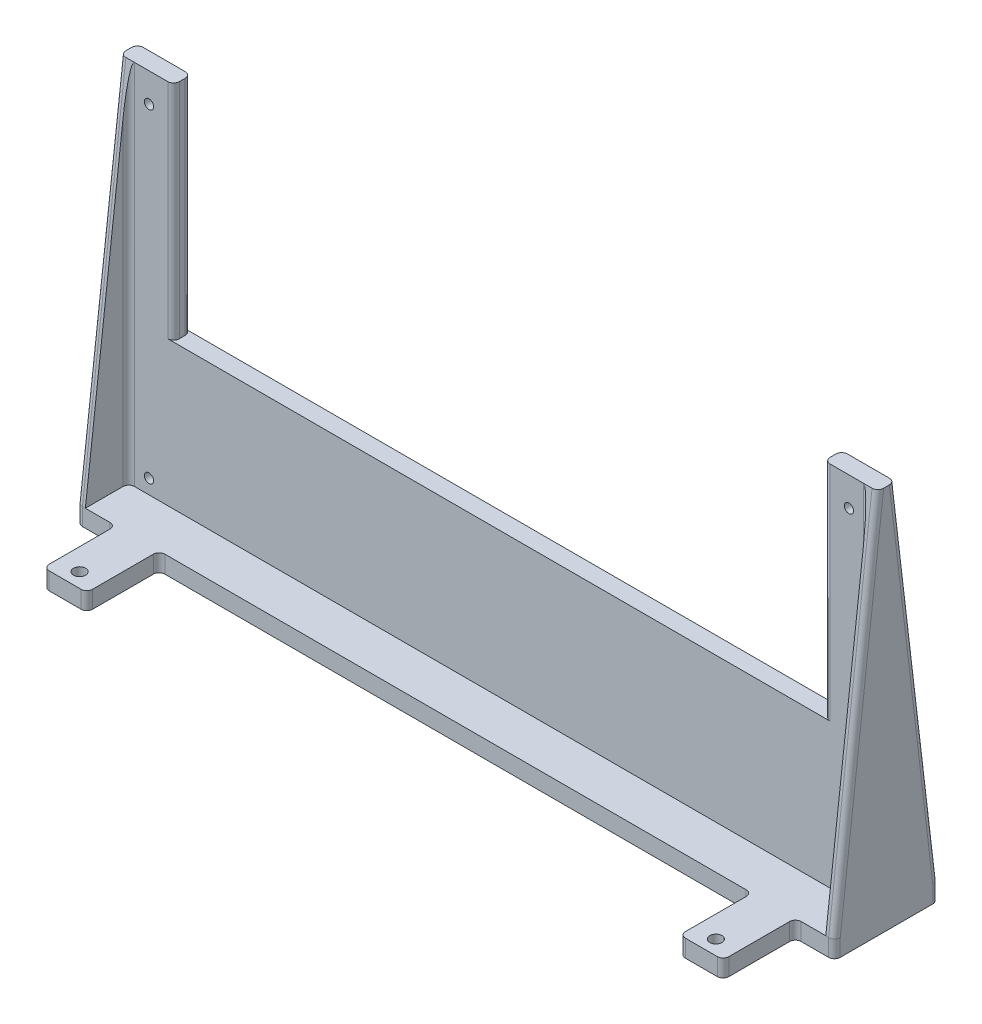
from build123d import *

# Parameters (mm, degrees)
SKETCH1_R               = 1.6
BOSS_EXTRUDE1_DEPTH     = 6
SKETCH5_W               = 262
SKETCH5_H               = 6
BOSS_EXTRUDE3_DEPTH     = 40
SKETCH5_2_W             = 262
SKETCH5_2_H             = 6
BOSS_EXTRUDE5_DEPTH     = 30
SKETCH3_R               = 2.1
CUT_EXTRUDE1_DEPTH      = 189.164821367
SKETCH6_W               = 225
SKETCH6_H               = 77
CUT_EXTRUDE2_DEPTH      = 153.47950682
BOSS_EXTRUDE7_DEPTH     = 20
CUT_EXTRUDE4_DEPTH      = 189.164821367
CUT_EXTRUDE4_DEPTH_BACK = 189.164821367
SKETCH11_W              = 36
SKETCH11_H              = 9
SKETCH11_W_2            = 13.5
SKETCH11_H_2            = 25
SKETCH11_W_3            = 205
BOSS_EXTRUDE4_DEPTH     = 3
BOSS_EXTRUDE6_DEPTH     = 3
FILLET1_R               = 2


with BuildPart() as part:
    # Sketch1 → Boss-Extrude1 (new body)
    with BuildSketch(Plane.XY):
        Polygon((-131, -66), (-131, 66), (131, 66), (131, -66), (131, -67), (-131, -67), align=None)
        with Locations((-121, 56)):
            Circle(SKETCH1_R, mode=Mode.SUBTRACT)
        with Locations((121, 56)):
            Circle(SKETCH1_R, mode=Mode.SUBTRACT)
        with Locations((121, -56)):
            Circle(SKETCH1_R, mode=Mode.SUBTRACT)
        with Locations((-121, -56)):
            Circle(SKETCH1_R, mode=Mode.SUBTRACT)
    extrude(amount=BOSS_EXTRUDE1_DEPTH)

    # Sketch5 → Boss-Extrude3 (add)
    with BuildSketch(Plane.XY.offset(6)):
        with Locations((0, -64)):
            Rectangle(SKETCH5_W, SKETCH5_H)
    extrude(amount=BOSS_EXTRUDE3_DEPTH)

    # Sketch5<2> → Boss-Extrude5 (add)
    with BuildSketch(Plane.XY.offset(6)):
        with Locations((0, -64)):
            Rectangle(SKETCH5_2_W, SKETCH5_2_H)
    extrude(amount=-BOSS_EXTRUDE5_DEPTH)

    # Sketch3 → Cut-Extrude1 (cut, through all)
    with BuildSketch(Plane(origin=(0, -61, 0), x_dir=(1, 0, 0), z_dir=(0, 1, 0))):
        with Locations(Location((-110, -41, 0), (0, 0, 270))):
            Circle(SKETCH3_R)
        with Locations(Location((110, -41, 0), (0, 0, 270))):
            Circle(SKETCH3_R)
        with Locations(Location((-90, 19, 0), (0, 0, 270))):
            Circle(SKETCH3_R)
        with Locations(Location((90, 19, 0), (0, 0, 270))):
            Circle(SKETCH3_R)
    extrude(amount=-CUT_EXTRUDE1_DEPTH, mode=Mode.SUBTRACT)

    # Sketch6 → Cut-Extrude2 (cut, through all)
    with BuildSketch(Plane.XY.offset(6)):
        with Locations((0, 27.5)):
            Rectangle(SKETCH6_W, SKETCH6_H)
    extrude(amount=-CUT_EXTRUDE2_DEPTH, mode=Mode.SUBTRACT)

    # Sketch9 → Boss-Extrude7 (add)
    with BuildSketch(Plane(origin=(0, -61, 0), x_dir=(1, 0, 0), z_dir=(0, 1, 0))):
        Polygon((-81.5, 24), (-81.5, 0), (-77.5, 0), (-77.5, 20), (-57.5, 20), (-57.5, 24), align=None)
        Polygon((77.5, 20), (77.5, 0), (81.5, 0), (81.5, 24), (57.5, 24), (57.5, 20), align=None)
    extrude(amount=BOSS_EXTRUDE7_DEPTH)

    # Sketch11 → Cut-Extrude4 (cut, two sides: drawn at the far end of the back side and taken through both)
    with BuildSketch(Plane(origin=(0, -61, 0), x_dir=(1, 0, 0), z_dir=(0, 1, 0)).offset(-CUT_EXTRUDE4_DEPTH_BACK)):
        with Locations((-113, 19.5)):
            Rectangle(SKETCH11_W, SKETCH11_H)
        with Locations((113, 19.5)):
            Rectangle(SKETCH11_W, SKETCH11_H)
        with Locations((124.25, -33.5)):
            Rectangle(SKETCH11_W_2, SKETCH11_H_2)
        with Locations((-124.25, -33.5)):
            Rectangle(SKETCH11_W_2, SKETCH11_H_2)
        with Locations((0, -33.5)):
            Rectangle(SKETCH11_W_3, SKETCH11_H_2)
    extrude(amount=CUT_EXTRUDE4_DEPTH + CUT_EXTRUDE4_DEPTH_BACK, mode=Mode.SUBTRACT)

    # Sketch8 → Boss-Extrude4 (add)
    with BuildSketch(Plane(origin=(131, 0, 0), x_dir=(0, 0, -1), z_dir=(1, 0, 0))):
        Polygon((-6, 66), (-21, -61), (-6, -61), align=None)
        Polygon((0, 66), (0, -61), (15, -61), align=None)
    extrude(amount=-BOSS_EXTRUDE4_DEPTH)

    # Sketch7 → Boss-Extrude6 (add)
    with BuildSketch(Plane.ZY.offset(131)):
        Polygon((6, 66), (21, -61), (6, -61), align=None)
        Polygon((0, 66), (-15, -61), (0, -61), align=None)
    extrude(amount=-BOSS_EXTRUDE6_DEPTH)

    # Fillet1
    fillet1_edges = [part.edges().sort_by_distance(p)[0] for p in [
        (128, 2.5, 6),
        (128, 2.5, 0),
        (-128, 2.5, 0),
        (-131, 2.5, -7.5),
        (-131, 2.5, 13.5),
        (-128, 2.5, 6),
        (131, 2.5, -7.5),
        (131, 2.5, 13.5),
        (-112.5, 27.5, 6),
        (-112.5, 27.5, 0),
        (112.5, 27.5, 6),
        (112.5, 27.5, 0),
        (-131, -64, -15),
        (-95, -64, -15),
        (-95, -64, -24),
        (-81.5, -51, 0),
        (81.5, -51, 0),
        (95, -64, -24),
        (95, -64, -15),
        (131, -64, -15),
        (-131, -64, 21),
        (-117.5, -64, 21),
        (102.5, -64, 21),
        (131, -64, 21),
        (-102.5, -64, 21),
        (117.5, -64, 21),
        (102.5, -64, 46),
        (117.5, -64, 46),
        (-117.5, -64, 46),
        (-102.5, -64, 46),
        (77.5, -51, 0),
        (-77.5, -51, 0),
        (-77.5, -51, -20),
        (77.5, -51, -20),
        (57.5, -51, -20),
        (-57.5, -51, -20),
        (-81.5, -51, -24),
        (-57.5, -51, -24),
        (57.5, -51, -24),
        (81.5, -51, -24),
    ]]
    fillet(fillet1_edges, radius=FILLET1_R - 0.0001)  # a hair under: the kernel refuses the full size


solid = part.part
